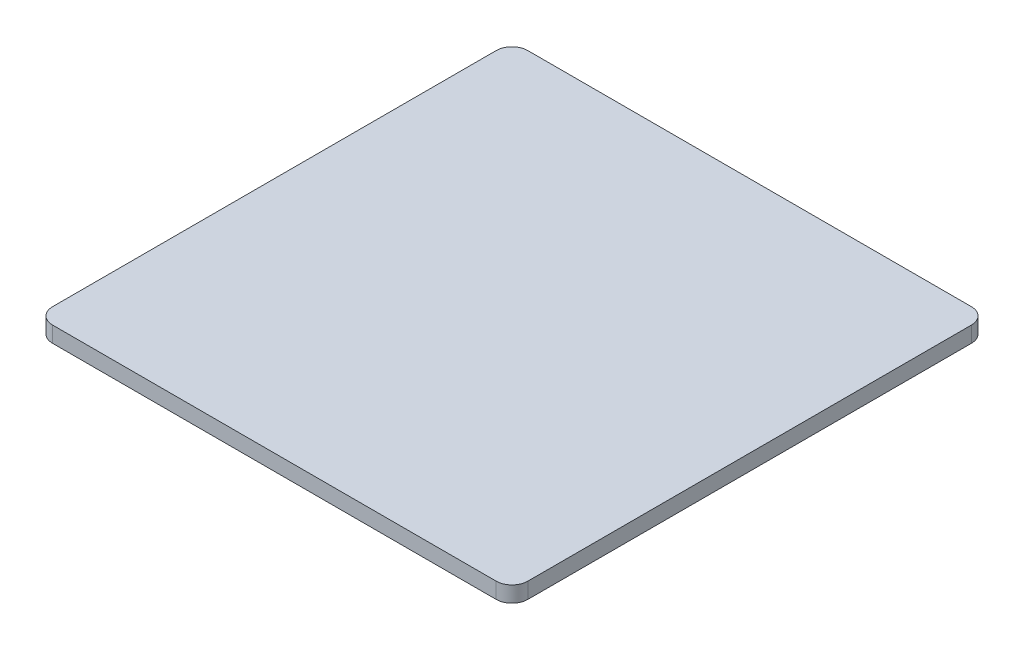
from build123d import *

# Parameters (mm, degrees)
BOSS_EXTRUDE1_DEPTH = 10


with BuildPart() as part:
    # Sketch1 → Boss-Extrude1 (new body)
    with BuildSketch(Plane(origin=(0, 0, 0), x_dir=(1, 0, 0), z_dir=(0, 1, 0))):
        with BuildLine():
            ThreePointArc((-150, -140), (-147.071067812, -147.071067812), (-140, -150))
            Line((-140, -150), (140, -150))
            ThreePointArc((140, -150), (147.071067812, -147.071067812), (150, -140))
            Line((150, -140), (150, 140))
            ThreePointArc((150, 140), (147.071067812, 147.071067812), (140, 150))
            Line((140, 150), (-140, 150))
            ThreePointArc((-140, 150), (-147.071067812, 147.071067812), (-150, 140))
            Line((-150, 140), (-150, -140))
        make_face()
    extrude(amount=BOSS_EXTRUDE1_DEPTH)


solid = part.part
